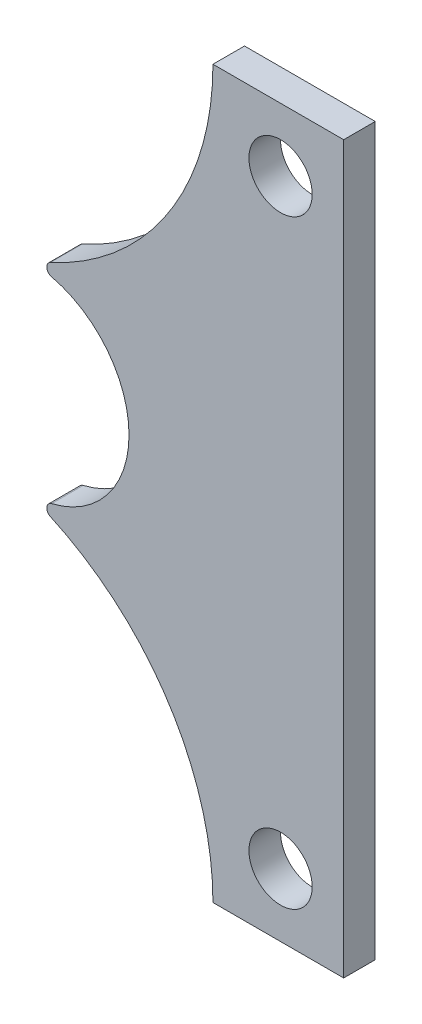
from build123d import *

# Parameters (mm, degrees)
SKETCH1_R           = 6.3627
BOSS_EXTRUDE1_DEPTH = 3.175
FILLET1_R           = 1.27


with BuildPart() as part:
    # Sketch1 → Boss-Extrude1 (new, symmetric)
    with BuildSketch(Plane.XY):
        with BuildLine():
            Line((-7.246114065, -73.025), (19.05, -73.025))
            Line((19.05, -73.025), (19.05, 73.025))
            Line((19.05, 73.025), (-7.246114065, 73.025))
            ThreePointArc((-7.246114065, 73.025), (-17.484032962, 40.768426431), (-44.45, 20.32))
            ThreePointArc((-44.45, 20.32), (-24.13, 0), (-44.45, -20.32))
            ThreePointArc((-44.45, -20.32), (-17.484032962, -40.768426431), (-7.246114065, -73.025))
        make_face()
        with Locations((6.35, -60.325)):
            Circle(SKETCH1_R, mode=Mode.SUBTRACT)
        with Locations((6.35, 60.325)):
            Circle(SKETCH1_R, mode=Mode.SUBTRACT)
    extrude(amount=BOSS_EXTRUDE1_DEPTH, both=True)

    # Fillet1
    fillet1_edges = [part.edges().sort_by_distance(p)[0] for p in [
        (-44.45, -20.32, 0),
        (-44.45, 20.32, 0),
    ]]
    fillet(fillet1_edges, radius=FILLET1_R)


solid = part.part
